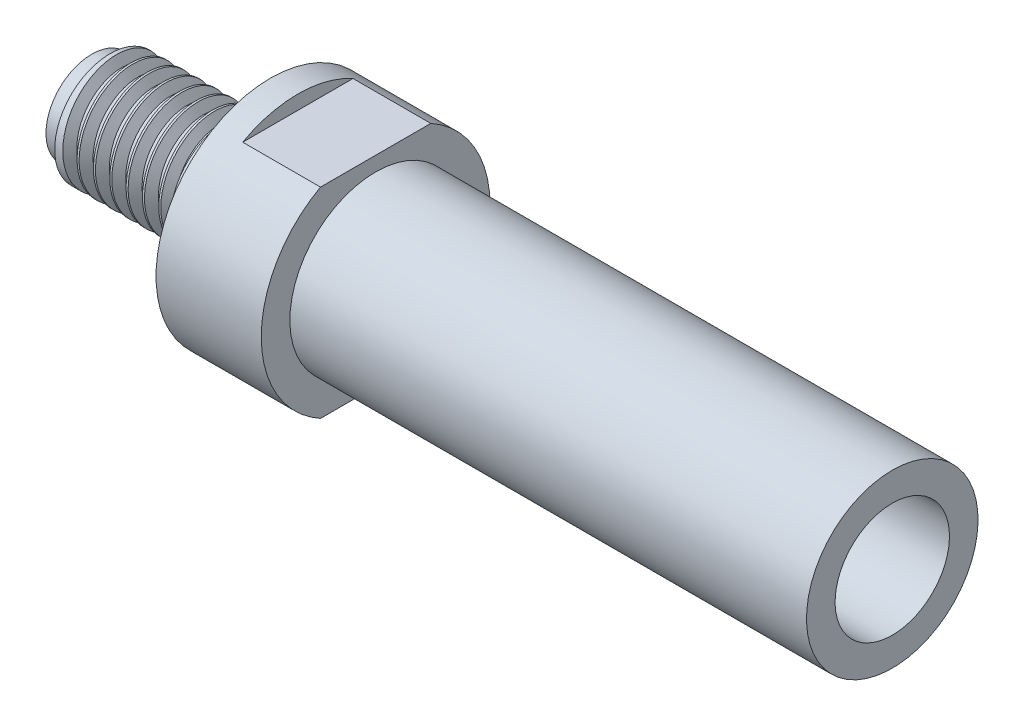
from build123d import *

# Parameters (mm, degrees)
SKETCH1_W          = 28.686125
SKETCH1_H          = 4.7625
SKETCH2_R          = 1.5875
CUT_EXTRUDE1_DEPTH = 46.348070521
SKETCH3_R          = 2.1828125
CUT_EXTRUDE2_DEPTH = 32.54375
SKETCH4_R          = 3.175
CUT_EXTRUDE3_DEPTH = 6.35
THREAD1_PITCH      = 0.907142857
SKETCH10_W         = 11.557
SKETCH10_H         = 3.302
CUT_EXTRUDE4_DEPTH = 4.318


with BuildPart() as part:
    # Sketch1 → Revolve1 (revolve)
    with BuildSketch(Plane.XY):
        Polygon((0, 0), (0, 4.7625), (0, 6.35), (-5.842, 6.35), (-5.842, 3.1623), (-8.22325, 3.1623), (-8.22325, 3.0734), (-14.747875, 3.0734), (-14.747875, 2.54), (-15.763875, 2.54), (-15.763875, 0), align=None)
        with Locations((14.3430625, 2.38125)):
            Rectangle(SKETCH1_W, SKETCH1_H)
    revolve(axis=Axis((0, 0, 0), (-1, 0, 0)))

    # Sketch2 → Cut-Extrude1 (cut, through all)
    with BuildSketch(Plane(origin=(28.686125, 0, 0), x_dir=(0, 0, -1), z_dir=(1, 0, 0))):
        with Locations(Location((0, 0, 0), (0, 0, 90))):
            Circle(SKETCH2_R)
    extrude(amount=-CUT_EXTRUDE1_DEPTH, mode=Mode.SUBTRACT)

    # Sketch3 → Cut-Extrude2 (cut)
    with BuildSketch(Plane(origin=(28.686125, 0, 0), x_dir=(0, 0, -1), z_dir=(1, 0, 0))):
        with Locations(Location((0, 0, 0), (0, 0, 90))):
            Circle(SKETCH3_R)
    extrude(amount=-CUT_EXTRUDE2_DEPTH, mode=Mode.SUBTRACT)

    # Sketch4 → Cut-Extrude3 (cut)
    with BuildSketch(Plane(origin=(28.686125, 0, 0), x_dir=(0, 0, -1), z_dir=(1, 0, 0))):
        with Locations(Location((0, 0, 0), (0, 0, 90))):
            Circle(SKETCH4_R)
    extrude(amount=-CUT_EXTRUDE3_DEPTH, mode=Mode.SUBTRACT)

    # Thread1: the profile of Thread Profile1 profile screwed along a right-hand helix of 7.1925 turns, 8 arcs to a turn; built about Z, then put on its axis
    thread1_z = Axis((0, 0, 0), (0, 0, 1))
    thread1_corners = [(3.0737, 0, -0.000173205), (3.0737, 0, 0.793923203), (2.582394528, 0, 0.510267856), (2.582394528, 0, 0.283482142)]
    with BuildLine(mode=Mode.PRIVATE) as thread1_profile:
        Line(thread1_corners[0], thread1_corners[1])
        Line(thread1_corners[1], thread1_corners[2])
        Line(thread1_corners[2], thread1_corners[3])
        Line(thread1_corners[3], thread1_corners[0])
    thread1_cap = Face(thread1_profile.wire())
    thread1_turn_angles = [0, 22.5, 45, 67.5, 90, 112.5, 135, 157.5, 180, 202.5, 225, 247.5, 270, 292.5, 315, 337.5, 360]
    thread1_turn_weights = [1, 0.9238795325112867, 1, 0.9238795325112867, 1, 0.9238795325112867, 1, 0.9238795325112867, 1, 0.9238795325112867, 1, 0.9238795325112867, 1, 0.9238795325112867, 1, 0.9238795325112867, 1]
    thread1_turn_rails = [Edge.make_bspline([Vector(p[0], p[1], 0).rotate(thread1_z, thread1_turn_angles[k]) / thread1_turn_weights[k] + Vector(0, 0, p[2] + THREAD1_PITCH * thread1_turn_angles[k] / 360) for k in range(17)], [0, 0, 0, 1, 1, 2, 2, 3, 3, 4, 4, 5, 5, 6, 6, 7, 7, 8, 8, 8], 2, thread1_turn_weights) for p in thread1_corners]
    thread1_turn_sides = [Face.make_surface_from_curves(thread1_turn_rails[p[0]], thread1_turn_rails[p[1]]) for p in [(0, 1), (1, 2), (2, 3), (3, 0)]]
    thread1_last_angles = [2520, 2542.5, 2565, 2577.15, 2589.3]
    thread1_last_weights = [1, 0.9238795325112867, 1, 0.9775999377647895, 1]
    thread1_last_rails = [Edge.make_bspline([Vector(p[0], p[1], 0).rotate(thread1_z, thread1_last_angles[k]) / thread1_last_weights[k] + Vector(0, 0, p[2] + THREAD1_PITCH * thread1_last_angles[k] / 360) for k in range(5)], [0, 0, 0, 1, 1, 2, 2, 2], 2, thread1_last_weights) for p in thread1_corners]
    thread1_last_sides = [Face.make_surface_from_curves(thread1_last_rails[p[0]], thread1_last_rails[p[1]]) for p in [(0, 1), (1, 2), (2, 3), (3, 0)]]
    thread1 = Plane(origin=(-14.747875, 0, 0), x_dir=(0, 0, -1), z_dir=(1, 0, 0)) * Solid(Shell([*[p.moved(Location((0, 0, THREAD1_PITCH * i))) for i in range(7) for p in thread1_turn_sides], *thread1_last_sides, thread1_cap, thread1_cap.rotate(thread1_z, 2589.3).moved(Location((0, 0, THREAD1_PITCH * 2589.3 / 360)))]))
    add(thread1, mode=Mode.SUBTRACT)

    # Sketch10 → Cut-Extrude4 (cut)
    with BuildSketch(Plane(origin=(0, 0, 0), x_dir=(0, 0, -1), z_dir=(1, 0, 0))):
        with Locations((0, 7.2136)):
            Rectangle(SKETCH10_W, SKETCH10_H)
        with Locations((0, -7.2136)):
            Rectangle(SKETCH10_W, SKETCH10_H)
    extrude(amount=-CUT_EXTRUDE4_DEPTH, mode=Mode.SUBTRACT)


solid = part.part
